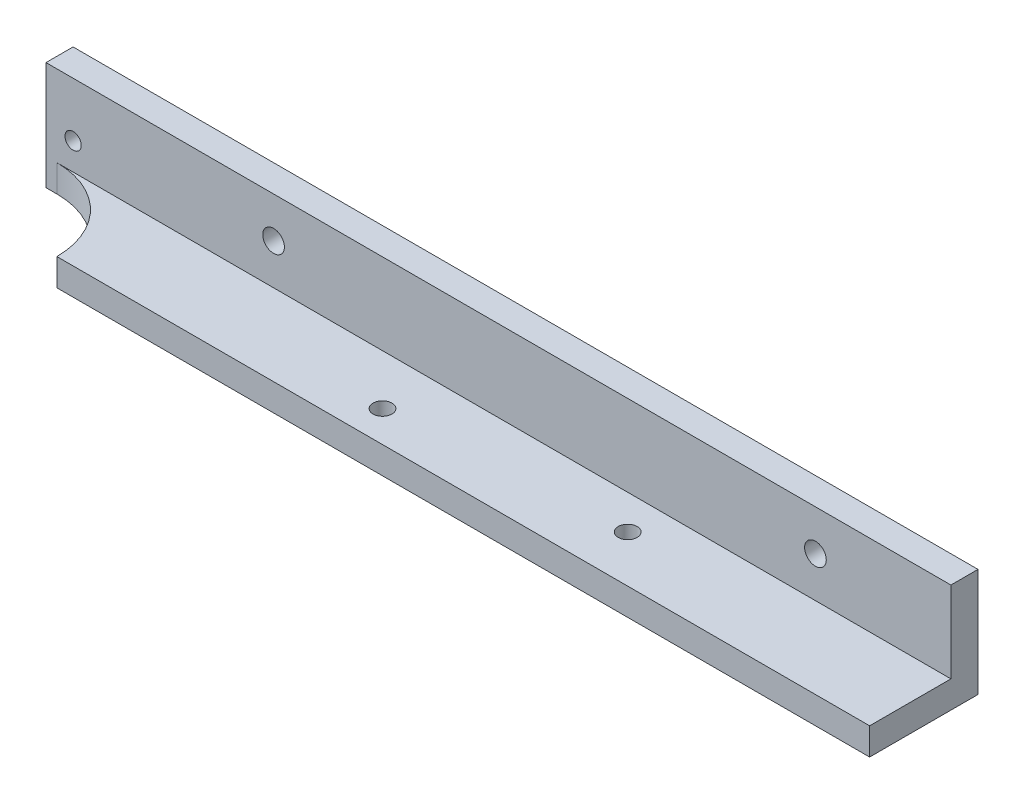
from build123d import *

# Parameters (mm, degrees)
SKETCH1_W           = 150
SKETCH1_H           = 20
BOSS_EXTRUDE1_DEPTH = 5
SKETCH3_W           = 150
SKETCH3_H           = 5
BOSS_EXTRUDE2_DEPTH = 15
SKETCH5_R           = 2
CUT_EXTRUDE1_DEPTH  = 152.492574075
SKETCH6_R           = 1.75
CUT_EXTRUDE2_DEPTH  = 153.069063257
SKETCH7_W           = 5
SKETCH7_H           = 20
BOSS_EXTRUDE3_DEPTH = 17
SKETCH8_R           = 1.5
CUT_EXTRUDE3_DEPTH  = 152.492574075
FILLET2_R           = 15


with BuildPart() as part:
    # Sketch1 → Boss-Extrude1 (new body)
    with BuildSketch(Plane(origin=(0, 0, 0), x_dir=(1, 0, 0), z_dir=(0, 1, 0))):
        with Locations((75, 10)):
            Rectangle(SKETCH1_W, SKETCH1_H)
    extrude(amount=-BOSS_EXTRUDE1_DEPTH)

    # Sketch3 → Boss-Extrude2 (add)
    with BuildSketch(Plane(origin=(0, 0, 0), x_dir=(1, 0, 0), z_dir=(0, 1, 0))):
        with Locations((75, 17.5)):
            Rectangle(SKETCH3_W, SKETCH3_H)
    extrude(amount=BOSS_EXTRUDE2_DEPTH)

    # Sketch5 → Cut-Extrude1 (cut, through all)
    with BuildSketch(Plane.XY.offset(-15)):
        with Locations((25, 7.5)):
            Circle(SKETCH5_R)
        with Locations((125, 7.5)):
            Circle(SKETCH5_R)
    extrude(amount=-CUT_EXTRUDE1_DEPTH, mode=Mode.SUBTRACT)

    # Sketch6 → Cut-Extrude2 (cut, through all)
    with BuildSketch(Plane(origin=(0, 0, 0), x_dir=(1, 0, 0), z_dir=(0, 1, 0))):
        with Locations(Location((54.35, 5.75, 0), (0, 0, 270))):
            Circle(SKETCH6_R)
        with Locations(Location((96.7, 8.65, 0), (0, 0, 270))):
            Circle(SKETCH6_R)
    extrude(amount=-CUT_EXTRUDE2_DEPTH, mode=Mode.SUBTRACT)

    # Sketch7 → Boss-Extrude3 (add)
    with BuildSketch(Plane.ZY):
        with Locations((-17.5, 5)):
            Rectangle(SKETCH7_W, SKETCH7_H)
    extrude(amount=BOSS_EXTRUDE3_DEPTH)

    # Sketch8 → Cut-Extrude3 (cut, through all)
    with BuildSketch(Plane.XY.offset(-15)):
        with Locations((-12, 5)):
            Circle(SKETCH8_R)
    extrude(amount=-CUT_EXTRUDE3_DEPTH, mode=Mode.SUBTRACT)

    # Fillet2
    fillet2_edges = [part.edges().sort_by_distance(p)[0] for p in [
        (0, -2.5, -15),
    ]]
    fillet(fillet2_edges, radius=FILLET2_R - 0.0001)  # a hair under: the kernel refuses the full size


solid = part.part
